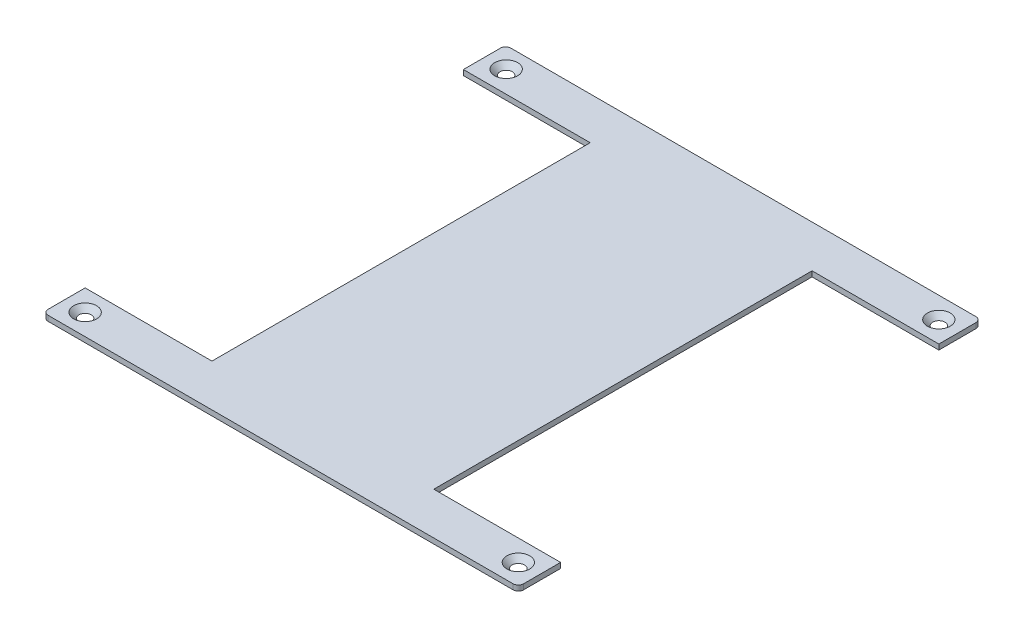
from build123d import *

# Parameters (mm, degrees)
SKETCH1_W                                    = 114.3
SKETCH1_H                                    = 111.252
BOSS_EXTRUDE1_DEPTH                          = 1.27
CSK_FOR_M2_5_COUNTERSUNK_FLAT_HEAD_S_2_COUNT = 2
CSK_FOR_M2_5_COUNTERSUNK_FLAT_HEAD_S_2_PITCH = 104.140077439
CSK_FOR_M2_5_COUNTERSUNK_FLAT_HEAD_S_3_COUNT = 2
CSK_FOR_M2_5_COUNTERSUNK_FLAT_HEAD_S_3_PITCH = 145.225430146
CSK_FOR_M2_5_COUNTERSUNK_FLAT_HEAD_S_4_COUNT = 2
CSK_FOR_M2_5_COUNTERSUNK_FLAT_HEAD_S_4_PITCH = 101.219
FILLET1_R                                    = 1.27
SKETCH9_W                                    = 30.48
SKETCH9_H                                    = 90.932
CUT_EXTRUDE5_DEPTH                           = 5.08


with BuildPart() as part:
    # Sketch1 → Boss-Extrude1 (new body)
    with BuildSketch(Plane(origin=(0, 0, 0), x_dir=(1, 0, 0), z_dir=(0, 1, 0))):
        with Locations((-13.076419672, -24.671311475)):
            Rectangle(SKETCH1_W, SKETCH1_H)
    extrude(amount=BOSS_EXTRUDE1_DEPTH)

    # Sketch3 → CSK for M2.5 Countersunk Flat Head Screw1 (revolve, cut)
    with BuildSketch(Plane(origin=(-65.146419672, 1.27, -26.001688525), x_dir=(0, 0, 1), z_dir=(1, 0, 0))):
        Polygon((0, 0), (0, 1.27), (1.45, 1.27), (1.45, 1.3), (2.75, 0), align=None)
    csk_for_m2_5_countersunk_flat_head_screw = revolve(axis=Axis((-65.146419672, 7.62, -26.001688525), (0, -1, 0)), mode=Mode.SUBTRACT)

    # CSK for M2.5 Countersunk Flat Head S 2: CSK for M2.5 Countersunk Flat Head Screw1 ×2
    with Locations(*[Vector(0.9999992563958324, 0, 0.0012195112882876242) * (i * CSK_FOR_M2_5_COUNTERSUNK_FLAT_HEAD_S_2_PITCH) for i in range(1, CSK_FOR_M2_5_COUNTERSUNK_FLAT_HEAD_S_2_COUNT)]):
        add(csk_for_m2_5_countersunk_flat_head_screw, mode=Mode.SUBTRACT)

    # CSK for M2.5 Countersunk Flat Head S 3: CSK for M2.5 Countersunk Flat Head Screw1 ×2
    with Locations(*[Vector(0.7170920402544414, 0, 0.6969784830277923) * (i * CSK_FOR_M2_5_COUNTERSUNK_FLAT_HEAD_S_3_PITCH) for i in range(1, CSK_FOR_M2_5_COUNTERSUNK_FLAT_HEAD_S_3_COUNT)]):
        add(csk_for_m2_5_countersunk_flat_head_screw, mode=Mode.SUBTRACT)

    # CSK for M2.5 Countersunk Flat Head S 4: CSK for M2.5 Countersunk Flat Head Screw1 ×2
    with Locations(*[(0, 0, i * CSK_FOR_M2_5_COUNTERSUNK_FLAT_HEAD_S_4_PITCH) for i in range(1, CSK_FOR_M2_5_COUNTERSUNK_FLAT_HEAD_S_4_COUNT)]):
        add(csk_for_m2_5_countersunk_flat_head_screw, mode=Mode.SUBTRACT)

    # Fillet1
    fillet1_edges = [part.edges().sort_by_distance(p)[0] for p in [
        (-70.226419672, 0.635, 80.297311475),
        (44.073580328, 0.635, 80.297311475),
        (44.073580328, 0.635, -30.954688525),
        (-70.226419672, 0.635, -30.954688525),
    ]]
    fillet(fillet1_edges, radius=FILLET1_R)

    # Sketch9 → Cut-Extrude5 (cut)
    with BuildSketch(Plane(origin=(0, 1.27, 0), x_dir=(1, 0, 0), z_dir=(0, 1, 0))):
        with Locations((28.833580328, -24.671311475)):
            Rectangle(SKETCH9_W, SKETCH9_H)
        with Locations((-54.986419672, -24.671311475)):
            Rectangle(SKETCH9_W, SKETCH9_H)
    extrude(amount=-CUT_EXTRUDE5_DEPTH, mode=Mode.SUBTRACT)


solid = part.part
